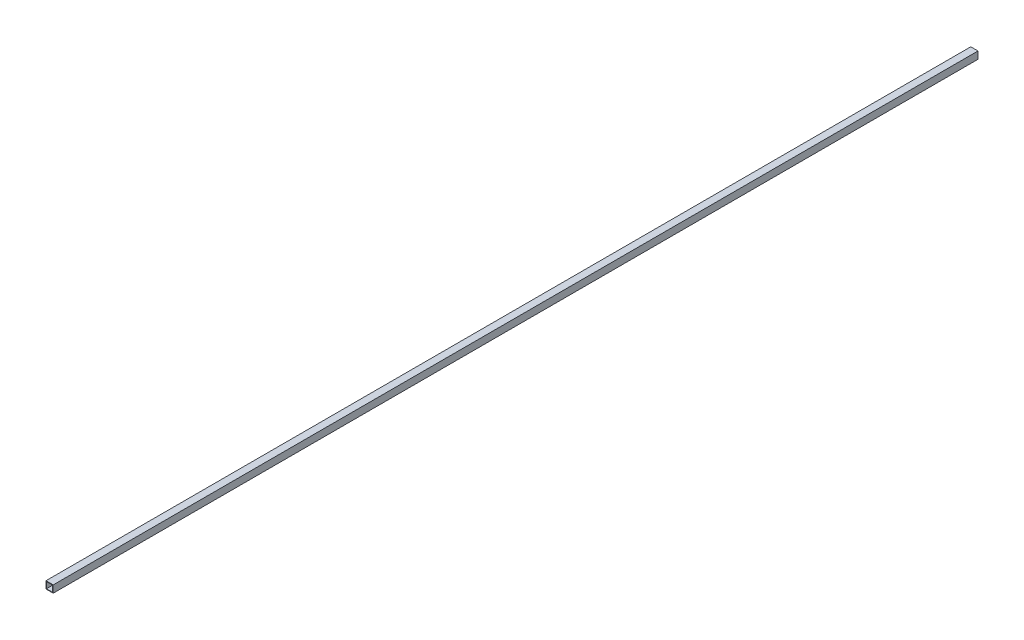
from build123d import *

# Parameters (mm, degrees)
SKETCH1_W           = 19.05
SKETCH1_H           = 19.05
SKETCH1_W_2         = 16.51
SKETCH1_H_2         = 16.51
BOSS_EXTRUDE1_DEPTH = 1219.2


with BuildPart() as part:
    # Sketch1 → Boss-Extrude1 (new, symmetric)
    with BuildSketch(Plane.XY):
        Rectangle(SKETCH1_W, SKETCH1_H)
        Rectangle(SKETCH1_W_2, SKETCH1_H_2, mode=Mode.SUBTRACT)
    extrude(amount=BOSS_EXTRUDE1_DEPTH, both=True)


solid = part.part
